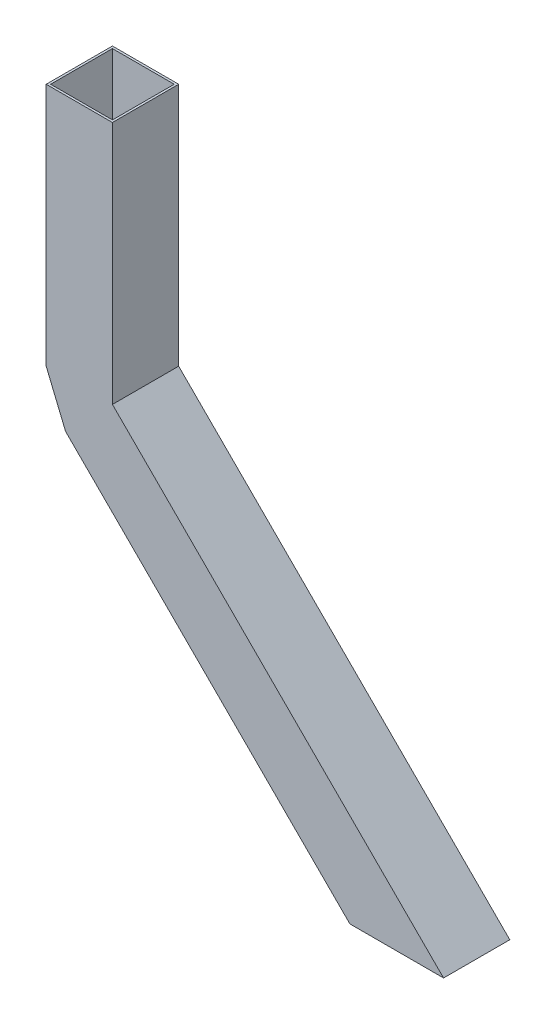
from build123d import *

# Parameters (mm, degrees)
CROQUIS1_W              = 60
CROQUIS1_H              = 60
CROQUIS1_W_2            = 56
CROQUIS1_H_2            = 56
SALIENTE_EXTRUIR1_DEPTH = 221.22
CROQUIS3_W              = 60
CROQUIS3_H              = 60
CROQUIS3_W_2            = 56
CROQUIS3_H_2            = 56
SALIENTE_EXTRUIR2_DEPTH = 424.26
CORTAR_EXTRUIR1_DEPTH   = 480.324498622
CROQUIS14_W             = 60
CROQUIS14_H             = 60
CROQUIS14_W_2           = 56
CROQUIS14_H_2           = 56


with BuildPart() as part:
    # Croquis1 → Saliente-Extruir1 (new body)
    with BuildSketch(Plane(origin=(0, 0, 0), x_dir=(1, 0, 0), z_dir=(0, 1, 0))):
        Rectangle(CROQUIS1_W, CROQUIS1_H)
        Rectangle(CROQUIS1_W_2, CROQUIS1_H_2, mode=Mode.SUBTRACT)
    extrude(amount=SALIENTE_EXTRUIR1_DEPTH)



with BuildPart() as body_2:
    # Croquis3 → Saliente-Extruir2 (new body)
    with BuildSketch(Plane(origin=(15, -15, 0), x_dir=(0, 0, -1), z_dir=(0.7071067811865512, -0.7071067811865438, 0))):
        with Locations((0, -8.786796564)):
            Rectangle(CROQUIS3_W, CROQUIS3_H)
        with Locations((0, -8.786796564)):
            Rectangle(CROQUIS3_W_2, CROQUIS3_H_2, mode=Mode.SUBTRACT)
    extrude(amount=SALIENTE_EXTRUIR2_DEPTH)

    # Croquis10 → Cortar-Extruir1 (cut, through all)
    with BuildSketch(Plane.XY.offset(30)):
        Polygon((287.570716115, -342.423529857), (329.997122986, -299.997122986), (245.144309244, -299.997122986), align=None)
    extrude(amount=-CORTAR_EXTRUIR1_DEPTH, mode=Mode.SUBTRACT)


with BuildPart() as part_1:
    add(part.part)

    add(body_2.part)  # Barrer2 merges body 2
    # Barrer2: sweep along a path in Croquis13
    with BuildLine(Plane.XY.offset(30)) as barrer2_path:
        Line((-12.426406871, -42.426406871), (-30, 0))
    # Croquis14 → Barrer2 (sweep)
    with BuildSketch(Plane(origin=(15, -15, 0), x_dir=(0, 0, 1), z_dir=(-0.7071067811865512, 0.7071067811865438, 0))):
        with Locations((0, -8.786796564)):
            Rectangle(CROQUIS14_W, CROQUIS14_H)
        with Locations((0, -8.786796564)):
            Rectangle(CROQUIS14_W_2, CROQUIS14_H_2, mode=Mode.SUBTRACT)
    sweep(path=barrer2_path.line)


solid = part_1.part
